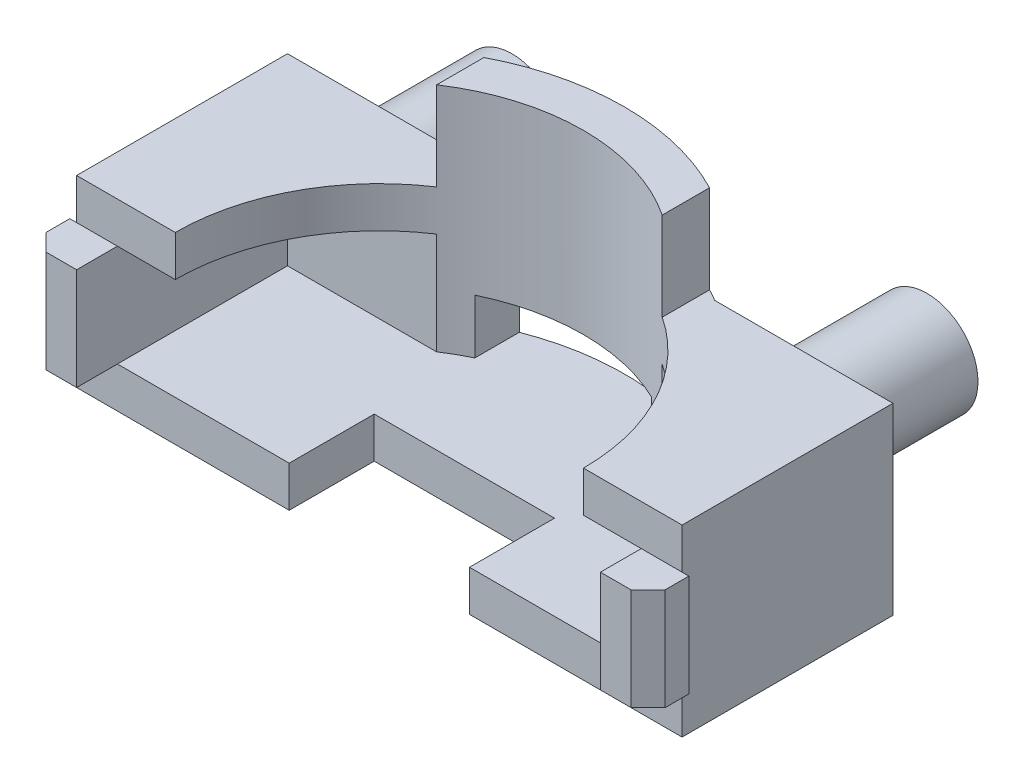
from build123d import *

# Parameters (mm, degrees)
SKETCH1_W                = 17.8
SKETCH1_H                = 6.2
BOSS_EXTRUDE1_DEPTH      = 5.4
SHELL1_T                 = -1.2
SKETCH2_W                = 6
SKETCH2_H                = 4.2
REVOLVE1_DEPTH           = 8
SKETCH5_W                = 1.864108749
SKETCH5_H                = 2.6
CUT_EXTRUDE1_DEPTH       = 5.4
SKETCH6_W                = 5.2
SKETCH6_H                = 1.6
CUT_EXTRUDE2_DEPTH       = 2.7
SKETCH7_R                = 1.5
BOSS_EXTRUDE2_DEPTH      = 3.8
SKETCH8_W                = 1.2
SKETCH8_H                = 3
BOSS_EXTRUDE3_DEPTH      = 1.4
CHAMFER1_SIZE            = 0.5
CHAMFER1_OF_MIRROR1_SIZE = 0.5
SKETCH9_W                = 5.3
SKETCH9_H                = 2.5
CUT_EXTRUDE3_DEPTH       = 5


# Read off the part's stored shape, not the designer's step: Revolve1
with BuildPart() as part:
    # Sketch1 → Boss-Extrude1 (new body)
    with BuildSketch(Plane(origin=(0, 0, 0), x_dir=(1, 0, 0), z_dir=(0, 1, 0))):
        Rectangle(SKETCH1_W, SKETCH1_H)
    extrude(amount=BOSS_EXTRUDE1_DEPTH)

    # Shell1
    shell1_openings = [part.faces().sort_by_distance(p)[0] for p in [
        (0, 2.7, 3.1),
    ]]
    offset(amount=SHELL1_T, openings=shell1_openings, kind=Kind.INTERSECTION)

    # Sketch2 → Cut-Revolve1 (revolve, cut)
    with BuildSketch(Plane.XY.offset(3.1)):
        with Locations((3, 3.3)):
            Rectangle(SKETCH2_W, SKETCH2_H)
    revolve(axis=Axis((0, 1.2, 3.1), (0, 1, 0)), mode=Mode.SUBTRACT)

    # Revolve1 outline → Revolve1 (add)
    with BuildSketch(Plane(origin=(0, 0, 0), x_dir=(1, 0, 0), z_dir=(0, 1, 0))):
        with BuildLine():
            Line((-5.180733539, 1.9), (-3.31662479, 1.9))
            ThreePointArc((-3.31662479, 1.9), (0, 2.9), (3.31662479, 1.9))
            Line((3.31662479, 1.9), (5.180733539, 1.9))
            ThreePointArc((5.180733539, 1.9), (0, 4.1), (-5.180733539, 1.9))
        make_face()
    extrude(amount=REVOLVE1_DEPTH)

    # Sketch5 → Cut-Extrude1 (cut)
    with BuildSketch(Plane.XY.offset(-1.9)):
        with Locations((-4.248679165, 6.7)):
            Rectangle(SKETCH5_W, SKETCH5_H)
        with Locations((4.248679165, 6.7)):
            Rectangle(SKETCH5_W, SKETCH5_H)
    extrude(amount=-CUT_EXTRUDE1_DEPTH, mode=Mode.SUBTRACT)

    # Sketch6 → Cut-Extrude2 (cut, symmetric)
    with BuildSketch(Plane(origin=(0, 0, -3.1), x_dir=(-1, 0, 0), z_dir=(0, 0, -1))):
        with Locations((0, 2)):
            Rectangle(SKETCH6_W, SKETCH6_H)
    extrude(amount=CUT_EXTRUDE2_DEPTH, both=True, mode=Mode.SUBTRACT)

    # Sketch7 → Boss-Extrude2 (add)
    with BuildSketch(Plane(origin=(0, 0, -3.1), x_dir=(-1, 0, 0), z_dir=(0, 0, -1))):
        with Locations(Location((6.1, 3.4, 0), (0, 0, 180))):
            Circle(SKETCH7_R)
        with Locations(Location((-6.1, 3.4, 0), (0, 0, 180))):
            Circle(SKETCH7_R)
    extrude(amount=BOSS_EXTRUDE2_DEPTH)

    # Sketch8 → Boss-Extrude3 (add)
    with BuildSketch(Plane.ZY.offset(-7.7)):
        with Locations((3.7, 2.7)):
            Rectangle(SKETCH8_W, SKETCH8_H)
    boss_extrude3 = extrude(amount=-BOSS_EXTRUDE3_DEPTH)

    # Chamfer1
    chamfer1_edges = [part.edges().sort_by_distance(p)[0] for p in [
        (9.1, 2.7, 4.3),
    ]]
    chamfer(chamfer1_edges, length=CHAMFER1_SIZE)

    # Mirror1: Boss-Extrude3 across plane
    add(boss_extrude3.mirror(Plane(origin=(0, 0, 0), x_dir=(0, 0, 1), z_dir=(1, 0, 0))))

    # Chamfer1 of Mirror1
    chamfer1_of_mirror1_edges = [part.edges().sort_by_distance(p)[0] for p in [
        (-9.1, 2.7, 4.3),
    ]]
    chamfer(chamfer1_of_mirror1_edges, length=CHAMFER1_OF_MIRROR1_SIZE)

    # Sketch9 → Cut-Extrude3 (cut, symmetric)
    with BuildSketch(Plane(origin=(0, 1.2, 0), x_dir=(1, 0, 0), z_dir=(0, 1, 0))):
        with Locations((0, -1.85)):
            Rectangle(SKETCH9_W, SKETCH9_H)
    extrude(amount=CUT_EXTRUDE3_DEPTH, both=True, mode=Mode.SUBTRACT)


solid = part.part
